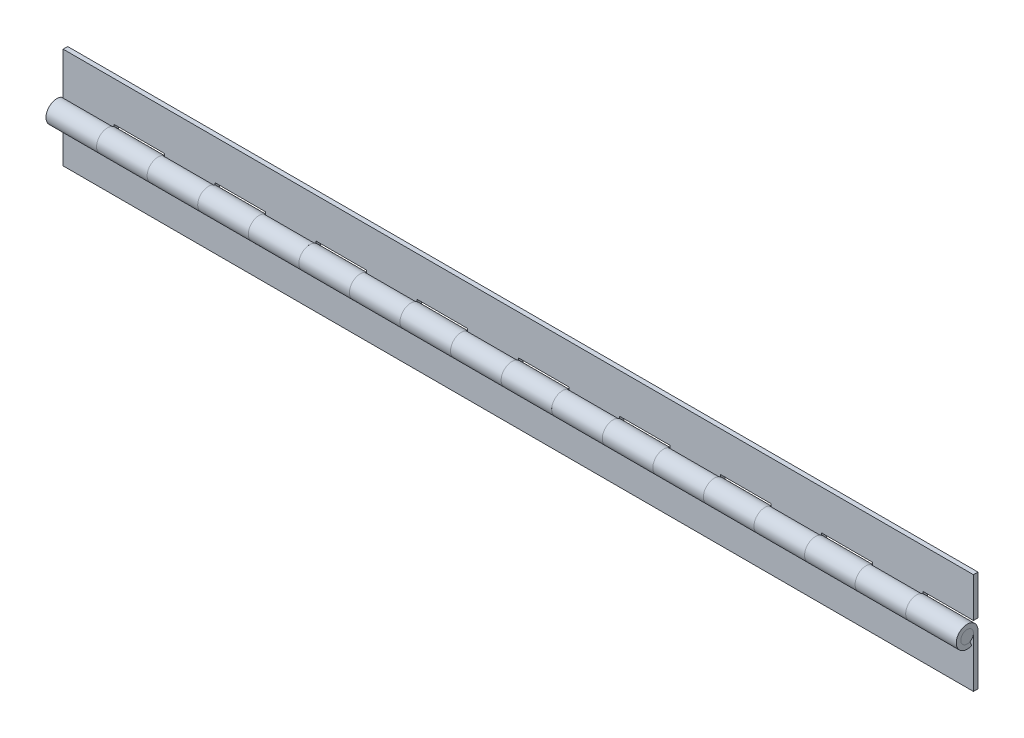
from build123d import *

# Parameters (mm, degrees)
BOSS_EXTRUDE1_DEPTH     = 304.8
SKETCH4_W               = 25.4
SKETCH4_H               = 10.922
CUT_EXTRUDE1_DEPTH      = 306.905250888
LPATTERN1_COUNT         = 12
LPATTERN1_PITCH         = 50.8
BOSS_EXTRUDE2_DEPTH     = 609.6
SKETCH6_W               = 25.4
SKETCH6_H               = 10.922
CUT_EXTRUDE2_DEPTH      = 306.905250888
LPATTERN2_COUNT         = 12
LPATTERN2_PITCH         = 50.8
SKETCH7_R               = 3.175
BOSS_EXTRUDE3_DEPTH     = 609.6
CHAMFER1_SIZE           = 0.635
CUT_EXTRUDE3_DEPTH      = 306.905250888
CUT_EXTRUDE3_DEPTH_BACK = 306.905250888
SKETCH8_OUTSIDE_W       = 733.962
SKETCH8_OUTSIDE_H       = 175.162
SKETCH8_OUTSIDE_W_2     = 457.2
SKETCH8_OUTSIDE_H_2     = 50.8


with BuildPart() as part:
    # Sketch3 → Boss-Extrude1 (new, symmetric)
    with BuildSketch(Plane(origin=(0, 0, 0), x_dir=(0, 0, -1), z_dir=(1, 0, 0))):
        with BuildLine():
            Line((1.341812981, -2.877527224), (2.307918327, -4.949346825))
            ThreePointArc((2.307918327, -4.949346825), (-4.605760686, 2.934193161), (5.461, 0))
            Line((5.461, 0), (5.461, -25.4))
            Line((5.461, -25.4), (3.175, -25.4))
            Line((3.175, -25.4), (3.175, -4.443185344))
            Line((3.175, -4.443185344), (3.175, 0))
            ThreePointArc((3.175, 0), (-2.67776784, 1.705926257), (1.341812981, -2.877527224))
        make_face()
    extrude(amount=BOSS_EXTRUDE1_DEPTH, both=True)

    # Sketch4 → Cut-Extrude1 (cut, symmetric)
    with BuildSketch(Plane.XY):
        with Locations((292.1, 0)):
            Rectangle(SKETCH4_W, SKETCH4_H)
    cut_extrude1 = extrude(amount=CUT_EXTRUDE1_DEPTH, both=True, mode=Mode.SUBTRACT)

    # LPattern1: Cut-Extrude1 ×12
    with Locations(*[(-i * LPATTERN1_PITCH, 0, 0) for i in range(1, LPATTERN1_COUNT)]):
        add(cut_extrude1, mode=Mode.SUBTRACT)


with BuildPart() as body_2:
    # Sketch5 → Boss-Extrude2 (new body)
    with BuildSketch(Plane(origin=(304.8, 0, 0), x_dir=(0, 0, -1), z_dir=(1, 0, 0))):
        with BuildLine():
            Line((3.175, 25.4), (3.175, 4.443185344))
            Line((3.175, 4.443185344), (3.175, 0))
            ThreePointArc((3.175, 0), (-2.67776784, -1.705926257), (1.341812981, 2.877527224))
            Line((1.341812981, 2.877527224), (2.307918327, 4.949346825))
            ThreePointArc((2.307918327, 4.949346825), (-4.605760686, -2.934193161), (5.461, 0))
            Line((5.461, 0), (5.461, 25.4))
            Line((5.461, 25.4), (3.175, 25.4))
        make_face()
    extrude(amount=-BOSS_EXTRUDE2_DEPTH)

    # Sketch6 → Cut-Extrude2 (cut, symmetric)
    with BuildSketch(Plane.XY):
        with Locations((266.7, 0)):
            Rectangle(SKETCH6_W, SKETCH6_H)
    cut_extrude2 = extrude(amount=CUT_EXTRUDE2_DEPTH, both=True, mode=Mode.SUBTRACT)

    # LPattern2: Cut-Extrude2 ×12
    with Locations(*[(-i * LPATTERN2_PITCH, 0, 0) for i in range(1, LPATTERN2_COUNT)]):
        add(cut_extrude2, mode=Mode.SUBTRACT)


with BuildPart() as body_3:
    # Sketch7 → Boss-Extrude3 (new body)
    with BuildSketch(Plane(origin=(304.8, 0, 0), x_dir=(0, 0, -1), z_dir=(1, 0, 0))):
        Circle(SKETCH7_R)
    extrude(amount=-BOSS_EXTRUDE3_DEPTH)

    # Chamfer1
    chamfer1_edges = [body_3.edges().sort_by_distance(p)[0] for p in [
        (-304.8, 0, 3.175),
        (304.8, 0, 3.175),
    ]]
    chamfer(chamfer1_edges, length=CHAMFER1_SIZE)


with BuildPart() as cut_extrude3_tool:
    # Sketch8 outside → Cut-Extrude3 (new, two sides: drawn at the far end of the back side and taken through both)
    with BuildSketch(Plane.XY.offset(-CUT_EXTRUDE3_DEPTH_BACK)):
        Rectangle(SKETCH8_OUTSIDE_W, SKETCH8_OUTSIDE_H)
        Rectangle(SKETCH8_OUTSIDE_W_2, SKETCH8_OUTSIDE_H_2, mode=Mode.SUBTRACT)
    extrude(amount=CUT_EXTRUDE3_DEPTH + CUT_EXTRUDE3_DEPTH_BACK)


with BuildPart() as part_1:
    add(part.part)

    # Cut-Extrude3: cut by cut_extrude3_tool
    add(cut_extrude3_tool.part, mode=Mode.SUBTRACT)


with BuildPart() as body_2_1:
    add(body_2.part)

    # Cut-Extrude3: cut by cut_extrude3_tool
    add(cut_extrude3_tool.part, mode=Mode.SUBTRACT)


with BuildPart() as body_3_1:
    add(body_3.part)

    # Cut-Extrude3: cut by cut_extrude3_tool
    add(cut_extrude3_tool.part, mode=Mode.SUBTRACT)


solid = Compound([part_1.part, body_2_1.part, body_3_1.part])
